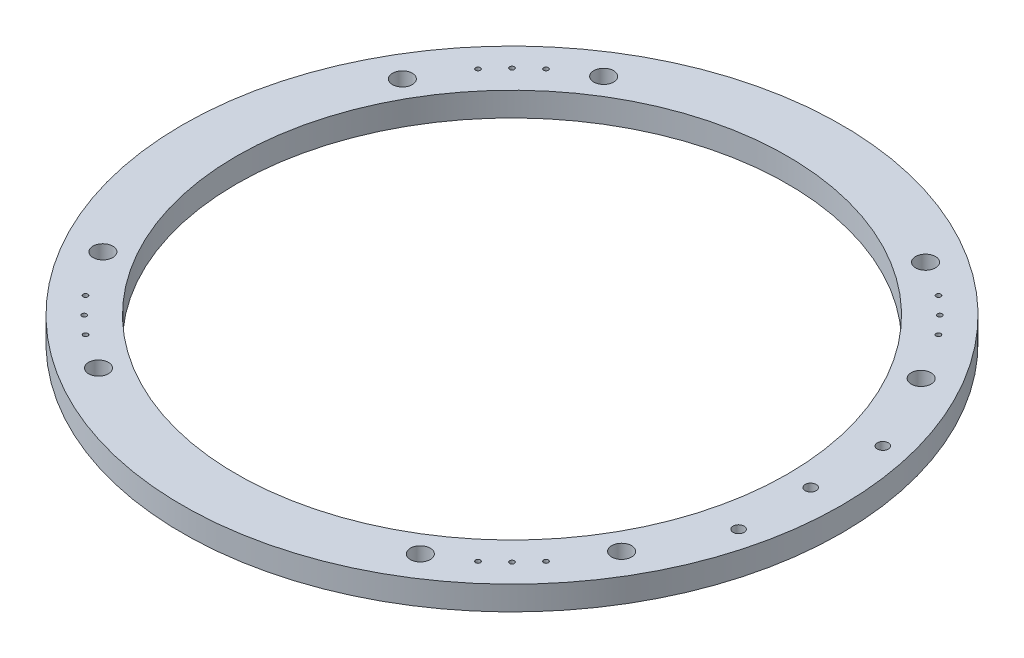
from build123d import *

# Parameters (mm, degrees)
TAP_DRILL_FOR_M3X0_5_TAP1_D = 2.5
CIRPATTERN1_COUNT           = 4
M5_CLEARANCE_HOLE1_D        = 5.8
Z_0_413_DIAMETER_HOLE1_D    = 10.4902


with BuildPart() as part:
    # Sketch1 → Revolve1 (revolve)
    with BuildSketch(Plane.XY):
        Polygon((145.526233777, 1064.895), (145.526233777, 1052.195), (152.4, 1052.195), (174.101233777, 1052.195), (174.101233777, 1064.895), align=None)
    revolve(axis=Axis((0, 1125.81516809, 0), (0, -1, 0)))

    # Tap Drill for M3x0.5 Tap1 (through all)
    with Locations(Plane(origin=(0, 1052.195, 0), x_dir=(-1, 0, 0), z_dir=(0, -1, 0))):
        with Locations((103.667734326, 121.628246568), (121.628246568, 103.667734326), (113.00537488, 113.00537488)):
            tap_drill_for_m3x0_5_tap1 = Hole(TAP_DRILL_FOR_M3X0_5_TAP1_D / 2)

    # CirPattern1: Tap Drill for M3x0.5 Tap1 ×4 about axis
    cirpattern1_axis = Axis((0, 1125.81516809, 0), (0, 1, 0))
    for i in range(1, CIRPATTERN1_COUNT):
        add(tap_drill_for_m3x0_5_tap1.rotate(cirpattern1_axis, i * 360 / CIRPATTERN1_COUNT), mode=Mode.SUBTRACT)

    # M5 Clearance Hole1 (through all)
    with Locations(Plane(origin=(0, 1064.895, 0), x_dir=(1, 0, 0), z_dir=(0, 1, 0))):
        with Locations((157.7975, -38.1), (157.7975, 0), (157.7975, 38.1)):
            Hole(M5_CLEARANCE_HOLE1_D / 2)

    # Z (0.413) Diameter Hole1 (through all)
    with Locations(Plane(origin=(0, 1064.895, 0), x_dir=(1, 0, 0), z_dir=(0, 1, 0))):
        with Locations((-137.027937996, -79.113116888), (137.027937996, -79.113116888), (137.027937996, 79.113116888), (-137.027937996, 79.113116888), (-85.014893438, 133.44665207), (85.014893438, 133.44665207), (85.014893438, -133.44665207), (-85.014893438, -133.44665207)):
            Hole(Z_0_413_DIAMETER_HOLE1_D / 2)


solid = part.part
